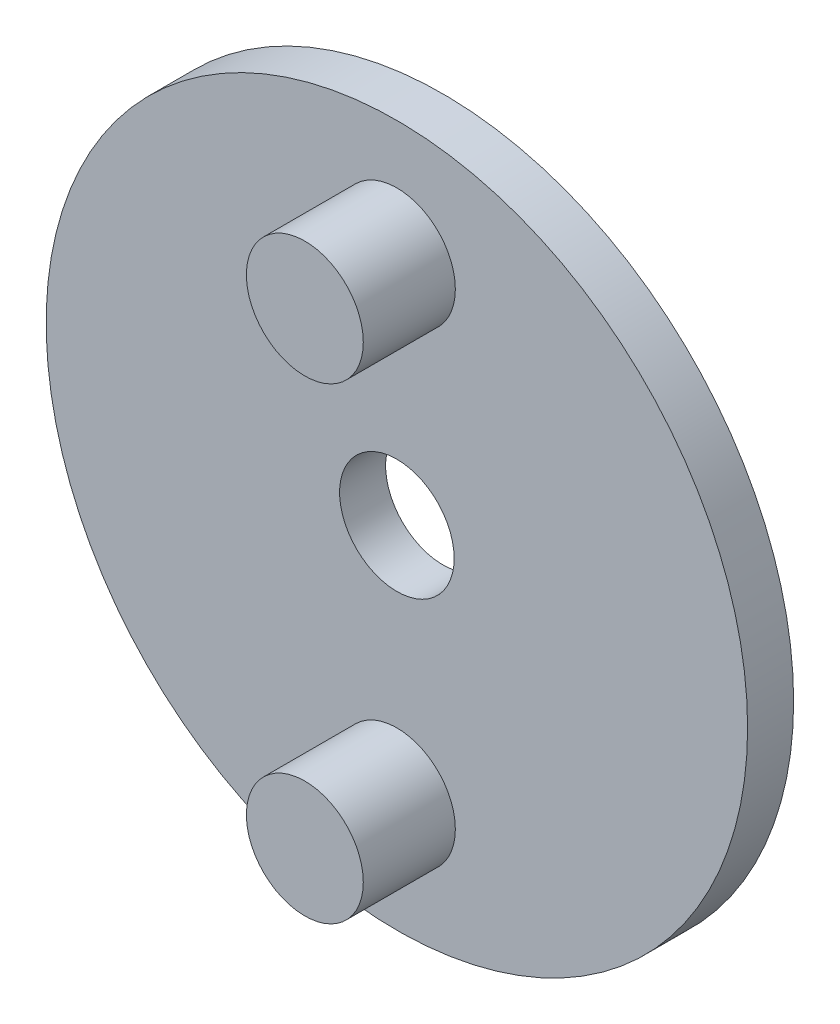
from build123d import *

# Parameters (mm, degrees)
SKETCH1_R           = 38.1
SKETCH1_R_2         = 6.223
SKETCH1_R_3         = 6.35
BOSS_EXTRUDE1_DEPTH = 5
SKETCH2_R           = 6.35
BOSS_EXTRUDE2_DEPTH = 15


with BuildPart() as part:
    # Sketch1 → Boss-Extrude1 (new body)
    with BuildSketch(Plane.XY):
        Circle(SKETCH1_R)
        Circle(SKETCH1_R_2, mode=Mode.SUBTRACT)
        with Locations((0, -25.4)):
            Circle(SKETCH1_R_3, mode=Mode.SUBTRACT)
        with Locations((0, 25.4)):
            Circle(SKETCH1_R_3, mode=Mode.SUBTRACT)
    extrude(amount=BOSS_EXTRUDE1_DEPTH)

    # Sketch2 → Boss-Extrude2 (add)
    with BuildSketch(Plane.XY):
        with Locations((0, -25.4)):
            Circle(SKETCH2_R)
        with Locations((0, 25.4)):
            Circle(SKETCH2_R)
    extrude(amount=BOSS_EXTRUDE2_DEPTH)


solid = part.part
